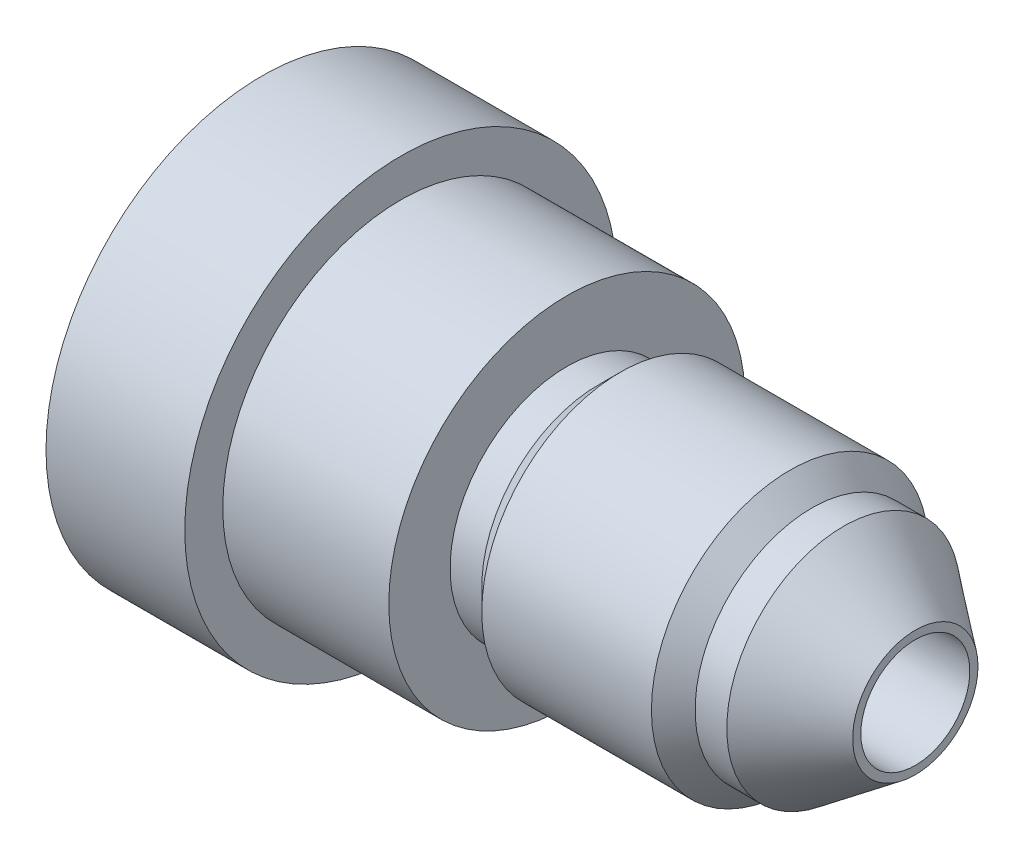
from build123d import *
from build123d.topology import SkipClean

# Parameters (mm, degrees)
CUT_SWEEP1_PITCH = 1.27


with BuildPart() as part:
    # Sketch1 → Revolve1 (revolve)
    with BuildSketch(Plane.XY, mode=Mode.PRIVATE) as revolve1_sk:
        Polygon((-13.0937, 8.6614), (-13.0937, 7.4803), (-6.065803329, 2.1844), (13.0937, 2.1844), (13.0937, 2.51206), (13.0937, 5.55625), (9.053923424, 5.55625), (-0.8763, 5.55625), (-0.8763, 7.1374), (-7.5311, 7.1374), (-7.5311, 8.6614), align=None)
    revolve(revolve1_sk.sketch.rotate(Axis((-13.0937, 0, 0), (1, 0, 0)), 90), axis=Axis((-13.0937, 0, 0), (1, 0, 0)))

    # Cut-Sweep1: the profile of Sketch4 profile screwed along a right-hand helix of 11 turns, 8 arcs to a turn; built about Z, then put on its axis
    cut_sweep1_z = Axis((0, 0, 0), (0, 0, 1))
    cut_sweep1_corners = [(5.55655, 0, 0.000173205), (5.55655, 0, -1.111423205), (4.731360803, 0, -0.635), (4.731360803, 0, -0.47625)]
    with BuildLine(mode=Mode.PRIVATE) as cut_sweep1_profile:
        Line(cut_sweep1_corners[0], cut_sweep1_corners[1])
        Line(cut_sweep1_corners[1], cut_sweep1_corners[2])
        Line(cut_sweep1_corners[2], cut_sweep1_corners[3])
        Line(cut_sweep1_corners[3], cut_sweep1_corners[0])
    cut_sweep1_cap = Face(cut_sweep1_profile.wire())
    cut_sweep1_turn_angles = [0, 22.5, 45, 67.5, 90, 112.5, 135, 157.5, 180, 202.5, 225, 247.5, 270, 292.5, 315, 337.5, 360]
    cut_sweep1_turn_weights = [1, 0.9238795325112867, 1, 0.9238795325112867, 1, 0.9238795325112867, 1, 0.9238795325112867, 1, 0.9238795325112867, 1, 0.9238795325112867, 1, 0.9238795325112867, 1, 0.9238795325112867, 1]
    cut_sweep1_turn_rails = [Edge.make_bspline([Vector(p[0], p[1], 0).rotate(cut_sweep1_z, cut_sweep1_turn_angles[k]) / cut_sweep1_turn_weights[k] + Vector(0, 0, p[2] + CUT_SWEEP1_PITCH * cut_sweep1_turn_angles[k] / 360) for k in range(17)], [0, 0, 0, 1, 1, 2, 2, 3, 3, 4, 4, 5, 5, 6, 6, 7, 7, 8, 8, 8], 2, cut_sweep1_turn_weights) for p in cut_sweep1_corners]
    cut_sweep1_turn_sides = [Face.make_surface_from_curves(cut_sweep1_turn_rails[p[0]], cut_sweep1_turn_rails[p[1]]) for p in [(0, 1), (1, 2), (2, 3), (3, 0)]]
    cut_sweep1_turn = Solid(Shell([*cut_sweep1_turn_sides, cut_sweep1_cap, cut_sweep1_cap.rotate(cut_sweep1_z, 360).moved(Location((0, 0, CUT_SWEEP1_PITCH * 360 / 360)))]))
    cut_sweep1_each = [*[cut_sweep1_turn.moved(Location((0, 0, CUT_SWEEP1_PITCH * i))) for i in range(11)]]
    add(Plane(origin=(13.0937, 0, 0), x_dir=(0, 1, 0), z_dir=(-1, 0, 0)) * Compound([cut_sweep1_each[i] for i in range(0, 11, 2)]), mode=Mode.SUBTRACT)
    add(Plane(origin=(13.0937, 0, 0), x_dir=(0, 1, 0), z_dir=(-1, 0, 0)) * Compound([cut_sweep1_each[i] for i in range(1, 11, 2)]), mode=Mode.SUBTRACT)

    # Sketch5 → Cut-Revolve1 (revolve, cut)
    with BuildSketch(Plane.XY, mode=Mode.PRIVATE) as cut_revolve1_sk:
        Polygon((13.0937, 2.51206), (10.216002239, 4.680560803), (8.946002239, 4.680560803), (8.070313042, 5.55625), (13.0937, 5.55625), align=None)
        Polygon((-0.8763, 5.55625), (-0.8763, 4.680560803), (0.3937, 4.680560803), (1.269389197, 5.55625), align=None)
    revolve(cut_revolve1_sk.sketch.rotate(Axis((0, 0, 0), (-1, 0, 0)), 90), axis=Axis((0, 0, 0), (-1, 0, 0)), mode=Mode.SUBTRACT)

    # Sketch6 → Revolve2 (revolve)
    with SkipClean():  # the faces are left unmerged after this step: merging them gives an invalid solid
        with BuildSketch(Plane.XY, mode=Mode.PRIVATE) as revolve2_sk:
            Polygon((1.269389197, 5.55625), (0.3937, 4.680560803), (8.946002239, 4.680560803), (8.070313042, 5.55625), align=None)
        revolve(revolve2_sk.sketch.rotate(Axis((0, 0, 0), (-1, 0, 0)), 90), axis=Axis((0, 0, 0), (-1, 0, 0)))
    add(part.part.scale(1), mode=Mode.REPLACE)  # the faces are merged on a copy


solid = part.part
